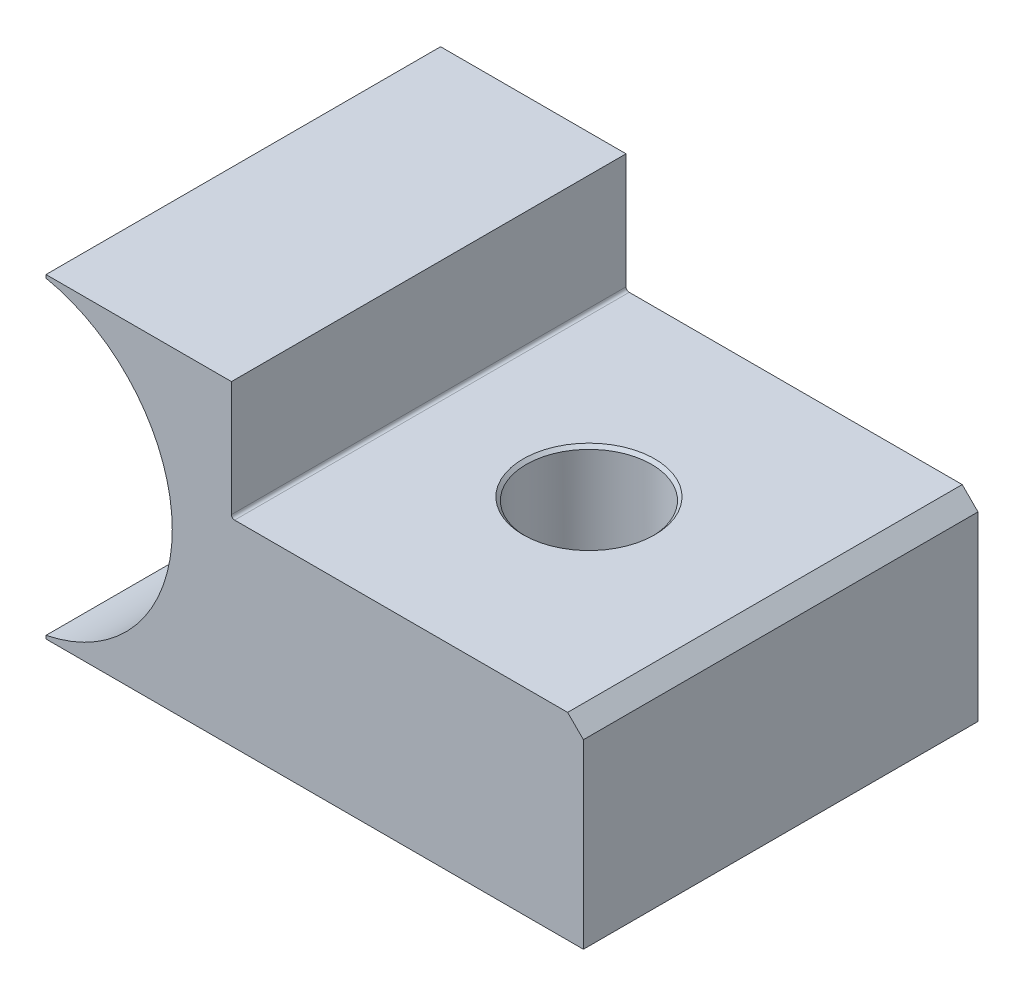
from build123d import *

# Parameters (mm, degrees)
BOSS_EXTRUDE1_DEPTH      = 31.75
X_0_397_DIAMETER_HOLE1_D = 10.0838
CHAMFER1_SIZE            = 1.27
CHAMFER2_SIZE            = 0.254
FILLET1_R                = 0.254


with BuildPart() as part:
    # Sketch1 → Boss-Extrude1 (new body)
    with BuildSketch(Plane.XY):
        with BuildLine():
            Line((2.54, 0), (45.7835, 0))
            Line((45.7835, 0), (45.7835, 15.875))
            Line((45.7835, 15.875), (17.4625, 15.875))
            Line((17.4625, 15.875), (17.4625, 25.4))
            Line((17.4625, 25.4), (2.54, 25.4))
            Line((2.54, 25.4), (2.54, 25.143407893))
            ThreePointArc((2.54, 25.143407893), (12.7, 12.7), (2.54, 0.256592107))
            Line((2.54, 0.256592107), (2.54, 0))
        make_face()
    extrude(amount=BOSS_EXTRUDE1_DEPTH)

    # X (0.397) Diameter Hole1 (through all)
    with Locations(Plane(origin=(0, 15.875, 0), x_dir=(1, 0, 0), z_dir=(0, 1, 0))):
        with Locations((30.353, -15.875)):
            Hole(X_0_397_DIAMETER_HOLE1_D / 2)

    # Chamfer1
    chamfer1_edges = [part.edges().sort_by_distance(p)[0] for p in [
        (45.7835, 15.875, 15.875),
    ]]
    chamfer(chamfer1_edges, length=CHAMFER1_SIZE)

    # Chamfer2
    chamfer2_edges = [part.edges().sort_by_distance(p)[0] for p in [
        (35.3949, 15.875, 15.875),
    ]]
    chamfer(chamfer2_edges, length=CHAMFER2_SIZE)

    # Fillet1
    fillet1_edges = [part.edges().sort_by_distance(p)[0] for p in [
        (17.4625, 15.875, 15.875),
    ]]
    fillet(fillet1_edges, radius=FILLET1_R)


solid = part.part
